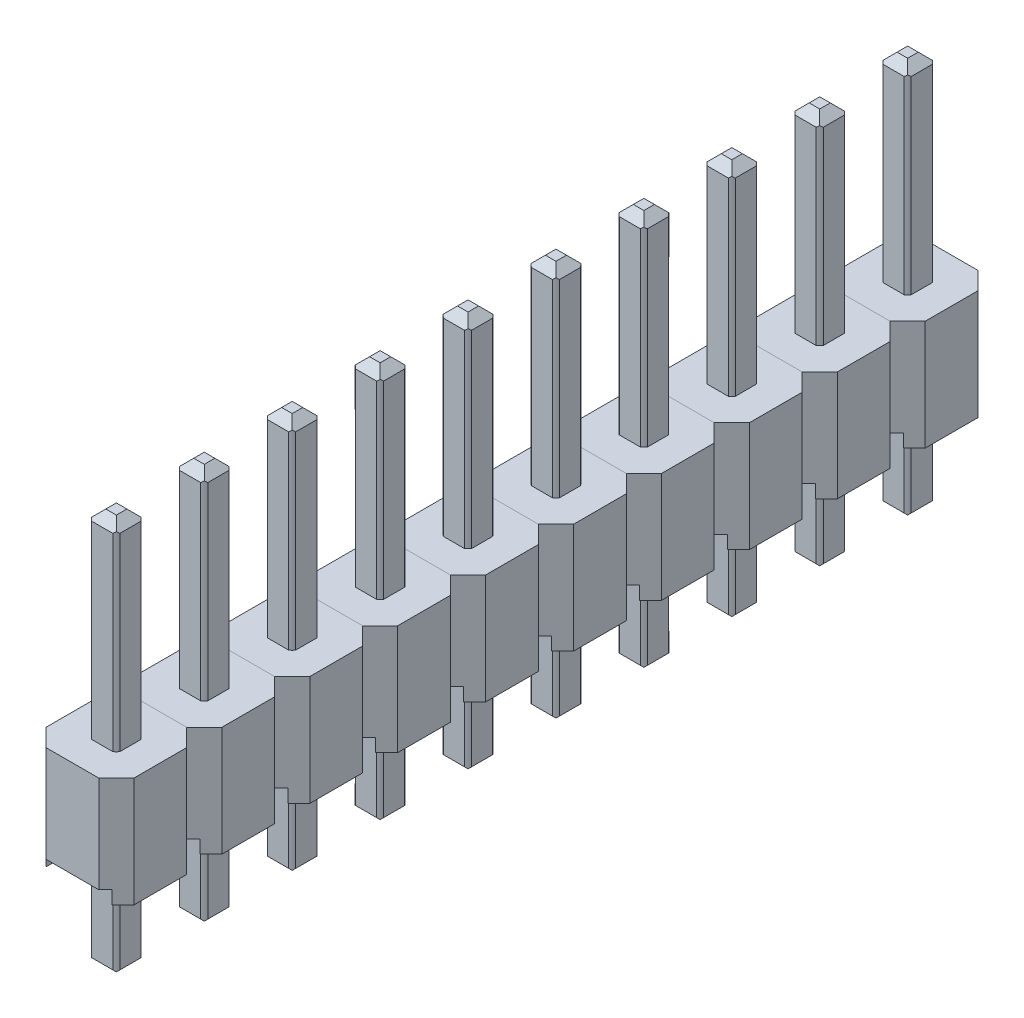
from build123d import *

# Parameters (mm, degrees)
SKETCH3_W                = 2
SKETCH3_H                = 2
BOSS_EXTRUDE3_DEPTH      = 2.5
SKETCH4_W                = 1.5
SKETCH4_H                = 0.3
CUT_EXTRUDE1_DEPTH       = 4.354101966
CHAMFER1_SIZE            = 0.4
BOSS_EXTRUDE4_DEPTH      = 7
BOSS_EXTRUDE4_DEPTH_BACK = 2
CHAMFER2_SIZE            = 0.2
LPATTERN1_COUNT          = 10
LPATTERN1_PITCH          = 2


with BuildPart() as part:
    # Sketch3 → Boss-Extrude3 (new body)
    with BuildSketch(Plane(origin=(0, 0, 0), x_dir=(1, 0, 0), z_dir=(0, 1, 0))):
        Rectangle(SKETCH3_W, SKETCH3_H)
    extrude(amount=BOSS_EXTRUDE3_DEPTH)

    # Sketch4 → Cut-Extrude1 (cut, through all)
    with BuildSketch(Plane.XY.offset(1)):
        with Locations((0, 0.15)):
            Rectangle(SKETCH4_W, SKETCH4_H)
    extrude(amount=-CUT_EXTRUDE1_DEPTH, mode=Mode.SUBTRACT)

    # Chamfer1
    chamfer1_edges = [part.edges().sort_by_distance(p)[0] for p in [
        (-1, 1.25, 1),
        (-1, 1.25, -1),
        (1, 1.25, -1),
        (1, 1.25, 1),
    ]]
    chamfer(chamfer1_edges, length=CHAMFER1_SIZE)

    # Sketch5 → Boss-Extrude4 (add, two sides: drawn at the far end of the back side and taken through both)
    with BuildSketch(Plane(origin=(0, 0, 0), x_dir=(1, 0, 0), z_dir=(0, 1, 0)).offset(-BOSS_EXTRUDE4_DEPTH_BACK)):
        with BuildLine():
            Line((-0.24, -0.32), (0.24, -0.32))
            ThreePointArc((0.24, -0.32), (0.282842712, -0.282842712), (0.32, -0.24))
            Line((0.32, -0.24), (0.32, 0.24))
            ThreePointArc((0.32, 0.24), (0.282842712, 0.282842712), (0.24, 0.32))
            Line((0.24, 0.32), (-0.24, 0.32))
            ThreePointArc((-0.24, 0.32), (-0.282842712, 0.282842712), (-0.32, 0.24))
            Line((-0.32, 0.24), (-0.32, -0.24))
            ThreePointArc((-0.32, -0.24), (-0.282842712, -0.282842712), (-0.24, -0.32))
        make_face()
    extrude(amount=BOSS_EXTRUDE4_DEPTH + BOSS_EXTRUDE4_DEPTH_BACK)

    # Chamfer2
    # the kernel refuses this chamfer: 0.2 mm, written as the material it takes off along each edge
    with BuildSketch(Plane(origin=(0.32, -2, 0.754336598), x_dir=(0.027495876610586285, 0.9996219169112968, 0), z_dir=(0, 0, -1)), Plane(origin=(0.754336598, -2, -0.32), x_dir=(0, 0.9996219169112968, -0.027495876610586285), z_dir=(-1, 0, 0)), Plane(origin=(-0.32, -2, -0.754336598), x_dir=(-0.027495876610586285, 0.9996219169112968, 0), z_dir=(0, 0, 1)), Plane(origin=(-0.754336598, -2, 0.32), x_dir=(0, 0.9996219169112968, 0.027495876610586285), z_dir=(1, 0, 0))) as chamfer2_piece_1:
        Polygon((CHAMFER2_SIZE * 0.999621916911, -CHAMFER2_SIZE * 0.0274958766106), (-CHAMFER2_SIZE * 0.0274958766106, -CHAMFER2_SIZE * 0.999621916911), (0, 0), align=None)
    extrude(amount=1.508673195, mode=Mode.SUBTRACT)
    with BuildSketch(Plane(origin=(-0.754336598, 7, 0.32), x_dir=(0, -0.9996219169112968, 0.027495876610586226), z_dir=(1, 0, 0)), Plane(origin=(-0.32, 7, -0.754336598), x_dir=(-0.027495876610586223, -0.9996219169112966, 0), z_dir=(0, 0, 1)), Plane(origin=(0.754336598, 7, -0.32), x_dir=(0, -0.9996219169112968, -0.027495876610586226), z_dir=(-1, 0, 0)), Plane(origin=(0.32, 7, 0.754336598), x_dir=(0.027495876610586223, -0.9996219169112966, 0), z_dir=(0, 0, -1))) as chamfer2_piece_2:
        Polygon((CHAMFER2_SIZE * 0.999621916911, CHAMFER2_SIZE * 0.0274958766106), (-CHAMFER2_SIZE * 0.0274958766106, CHAMFER2_SIZE * 0.999621916911), (0, 0), align=None)
    extrude(amount=1.508673195, mode=Mode.SUBTRACT)


with BuildPart() as lpattern1_1:
    # LPattern1: pattern copy
    add(part.part.moved(Location(Vector(0, 0, -1) * (1 * LPATTERN1_PITCH))))


with BuildPart() as lpattern1_2:
    # LPattern1: pattern copy
    add(part.part.moved(Location(Vector(0, 0, -1) * (2 * LPATTERN1_PITCH))))


with BuildPart() as lpattern1_3:
    # LPattern1: pattern copy
    add(part.part.moved(Location(Vector(0, 0, -1) * (3 * LPATTERN1_PITCH))))


with BuildPart() as lpattern1_4:
    # LPattern1: pattern copy
    add(part.part.moved(Location(Vector(0, 0, -1) * (4 * LPATTERN1_PITCH))))


with BuildPart() as lpattern1_5:
    # LPattern1: pattern copy
    add(part.part.moved(Location(Vector(0, 0, -1) * (5 * LPATTERN1_PITCH))))


with BuildPart() as lpattern1_6:
    # LPattern1: pattern copy
    add(part.part.moved(Location(Vector(0, 0, -1) * (6 * LPATTERN1_PITCH))))


with BuildPart() as lpattern1_7:
    # LPattern1: pattern copy
    add(part.part.moved(Location(Vector(0, 0, -1) * (7 * LPATTERN1_PITCH))))


with BuildPart() as lpattern1_8:
    # LPattern1: pattern copy
    add(part.part.moved(Location(Vector(0, 0, -1) * (8 * LPATTERN1_PITCH))))


with BuildPart() as lpattern1_9:
    # LPattern1: pattern copy
    add(part.part.moved(Location(Vector(0, 0, -1) * (9 * LPATTERN1_PITCH))))


solid = Compound([part.part, lpattern1_1.part, lpattern1_2.part, lpattern1_3.part, lpattern1_4.part, lpattern1_5.part, lpattern1_6.part, lpattern1_7.part, lpattern1_8.part, lpattern1_9.part])
